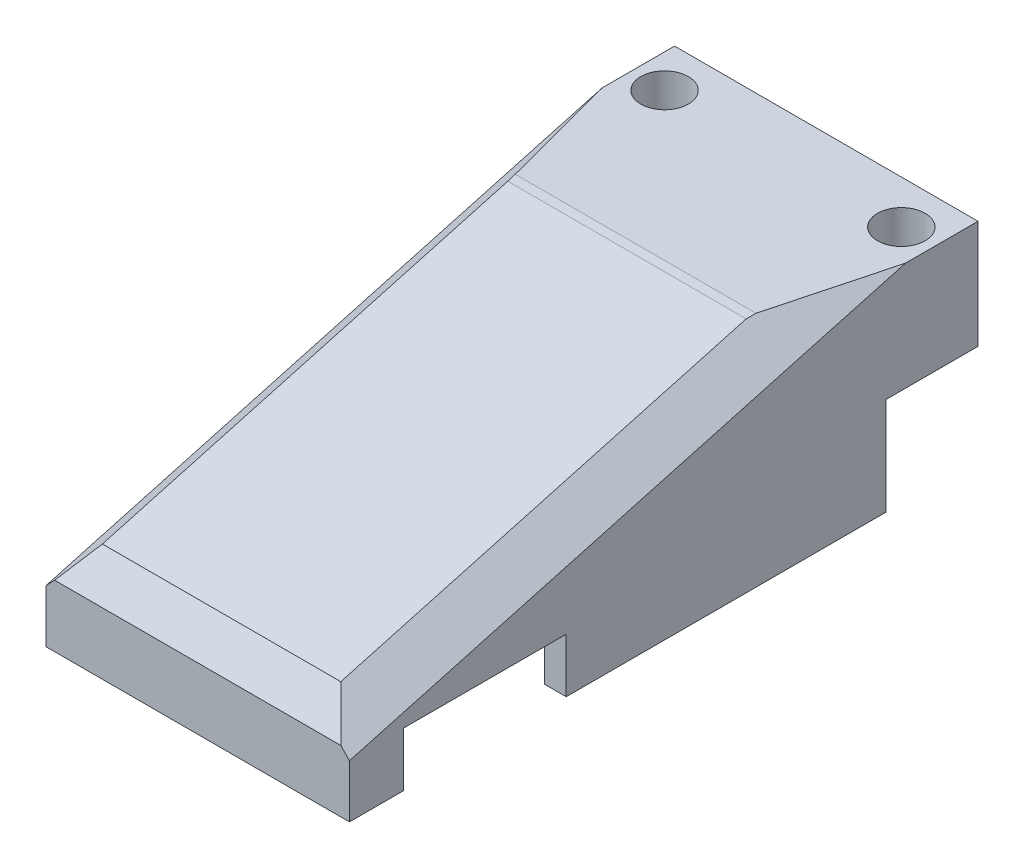
from build123d import *

# Parameters (mm, degrees)
BOSS_EXTRU_1_DEPTH                                = 4
ESQUISSE2_R                                       = 1.15
ENL_V_MAT_EXTRU_1_DEPTH                           = 18.663521733
CHAMBRAGE_POUR_VIS_SIX_PANS_CREUX_M21_D           = 2.2
CHAMBRAGE_POUR_VIS_SIX_PANS_CREUX_M21_CBORE_D     = 4.4
CHAMBRAGE_POUR_VIS_SIX_PANS_CREUX_M21_CBORE_DEPTH = 4
BOSS_EXTRU_2_DEPTH                                = 28
COQUE1_START                                      = -12
COQUE1_DEPTH                                      = 24
COQUE1_START_2                                    = -51.994775807
COQUE1_2_DEPTH                                    = 48.056615462
ENL_V_MAT_EXTRU_2_DEPTH                           = 11
ESQUISSE8_W                                       = 15
ESQUISSE8_H                                       = 5
ENL_V_MAT_EXTRU_3_DEPTH                           = 63


with BuildPart() as part:
    # Esquisse1 → Boss.-Extru.1 (new, symmetric)
    with BuildSketch(Plane.XY):
        Polygon((-14, 2), (-7.85, 2), (-7.85, 8.2), (4.95, 8.2), (7.85, 5.6), (7.85, 2), (14, 2), (14, 12), (-14, 12), align=None)
    extrude(amount=BOSS_EXTRU_1_DEPTH, both=True)

    # Esquisse2 → Enlèv. mat.-Extru.1 (cut, through all)
    with BuildSketch(Plane.XZ.offset(-2)):
        with Locations((10.925, 0)):
            Circle(ESQUISSE2_R)
        with Locations(Location((-10.925, 0, 0), (0, 0, 180))):
            Circle(ESQUISSE2_R)
    extrude(amount=-ENL_V_MAT_EXTRU_1_DEPTH, mode=Mode.SUBTRACT)

    # Chambrage pour vis à six pans creux M21 (through all)
    with Locations(Plane(origin=(0, 12, 0), x_dir=(1, 0, 0), z_dir=(0, 1, 0))):
        with Locations((-10.925, 0), (10.925, 0)):
            CounterBoreHole(CHAMBRAGE_POUR_VIS_SIX_PANS_CREUX_M21_D / 2, CHAMBRAGE_POUR_VIS_SIX_PANS_CREUX_M21_CBORE_D / 2, CHAMBRAGE_POUR_VIS_SIX_PANS_CREUX_M21_CBORE_DEPTH)

    # Esquisse6 → Boss.-Extru.2 (add)
    with BuildSketch(Plane.ZY.offset(14)):
        Polygon((4.5, 2), (4, 2), (4, 12), (14, 12), (54, 1), (54, -7), (4.5, -7), align=None)
    extrude(amount=-BOSS_EXTRU_2_DEPTH)

    # Chanfrein1
    # the kernel refuses this chamfer: 3 mm, written as the material it takes off along each edge
    with BuildSketch(Plane(origin=(-19.957306113, 1, 54), x_dir=(0, 0.2651564830210424, -0.9642053928037904), z_dir=(1, 0, 0))) as chanfrein1_piece_1:
        with BuildLine():
            Line((2.381812022, 0.07273839), (-0.701687646, -2.277268941))
            Line((-0.701687646, -2.277268941), (-0.75953997, -2.261359552))
            ThreePointArc((-0.75953997, -2.261359552), (-0.373628773, -1.132368609), (-0.057852324, 0.015909389))
            Line((-0.057852324, 0.015909389), (0, 0.06))
            ThreePointArc((0, 0.06), (1.190906011, 0.06), (2.381812022, 0.13273839))
            Line((2.381812022, 0.13273839), (2.381812022, 0.07273839))
        make_face()
    extrude(amount=39.914612227, mode=Mode.SUBTRACT)
    with BuildSketch(Plane(origin=(14, 15.477681924, 1.353883912), x_dir=(-1, 0, 0), z_dir=(0, -0.26515648302104217, 0.9642053928037905))) as chanfrein1_piece_2:
        with BuildLine():
            Line((3.084852814, -0.084852814), (-0.084852814, 3.084852814))
            Line((-0.084852814, 3.084852814), (-0.144852814, 3.084852814))
            ThreePointArc((-0.144852814, 3.084852814), (-0.06, 1.542426407), (-0.06, 0))
            Line((-0.06, 0), (0, -0.06))
            ThreePointArc((0, -0.06), (1.542426407, -0.06), (3.084852814, -0.144852814))
            Line((3.084852814, -0.144852814), (3.084852814, -0.084852814))
        make_face()
    extrude(amount=62.315569228, mode=Mode.SUBTRACT)
    with BuildSketch(Plane(origin=(-15.310375108, 12, 14), x_dir=(0, 0, -1), z_dir=(1, 0, 0))) as chanfrein1_piece_3:
        with BuildLine():
            Line((0.523904139, 0.016053697), (-0.509407938, -0.123437518))
            Line((-0.509407938, -0.123437518), (-0.525317327, -0.065585195))
            ThreePointArc((-0.525317327, -0.065585195), (-0.268484987, -0.011605966), (-0.015909389, 0.057852324))
            Line((-0.015909389, 0.057852324), (0, 0.06))
            ThreePointArc((0, 0.06), (0.261952069, 0.06), (0.523904139, 0.076053697))
            Line((0.523904139, 0.076053697), (0.523904139, 0.016053697))
        make_face()
    extrude(amount=30.620750216, mode=Mode.SUBTRACT)
    with BuildSketch(Plane(origin=(-14, 15.477681924, 1.353883912), x_dir=(1, 0, 0), z_dir=(0, -0.26515648302104217, 0.9642053928037905))) as chanfrein1_piece_4:
        with BuildLine():
            Line((3.084852814, 0.084852814), (-0.084852814, -3.084852814))
            Line((-0.084852814, -3.084852814), (-0.144852814, -3.084852814))
            ThreePointArc((-0.144852814, -3.084852814), (-0.06, -1.542426407), (-0.06, 0))
            Line((-0.06, 0), (0, 0.06))
            ThreePointArc((0, 0.06), (1.542426407, 0.06), (3.084852814, 0.144852814))
            Line((3.084852814, 0.144852814), (3.084852814, 0.084852814))
        make_face()
    extrude(amount=62.315569228, mode=Mode.SUBTRACT)

    # Coque1: read off the stored shape, not the designer's step
    # Coque1 outline → Coque1 (cut)
    with BuildSketch(Plane.YZ.offset(COQUE1_START)):
        Polygon((-7, 5.5), (10, 5.5), (10, 13.460632375), (9.928572392, 13.989748207), (-0.143118288, 50.614077951), (-1.961619074, 52), (-7, 52), align=None)
    extrude(amount=COQUE1_DEPTH, mode=Mode.SUBTRACT)

    # Coque1 2 outline → Coque1 2 (add)
    with BuildSketch(Plane(origin=(0, 0, 0), x_dir=(1, 0, 0), z_dir=(0, 0.26515648302104255, -0.9642053928037904)).offset(COQUE1_START_2)):
        Polygon((12, -11.454228351), (10.171572875, -13.282655476), (12, -13.282655476), align=None)
        Polygon((-10.171572875, -13.282655476), (-12, -11.454228351), (-12, -13.282655476), align=None)
    extrude(amount=COQUE1_2_DEPTH)

    # Esquisse7 → Enlèv. mat.-Extru.2 (cut)
    with BuildSketch(Plane(origin=(0, 0, -4), x_dir=(-1, 0, 0), z_dir=(0, 0, -1))):
        Polygon((-12, 2), (-12, -7), (12, -7), (12, 2), (7.85, 2), (-7.85, 2), align=None)
        Polygon((-7.85, 2), (7.85, 2), (7.85, 8.2), (-4.95, 8.2), (-7.85, 5.6), align=None)
    extrude(amount=-ENL_V_MAT_EXTRU_2_DEPTH, mode=Mode.SUBTRACT)

    # Esquisse8 → Enlèv. mat.-Extru.3 (cut, through all)
    with BuildSketch(Plane(origin=(14, 0, 0), x_dir=(0, 0, -1), z_dir=(1, 0, 0))):
        with Locations((-41.5, -4.5)):
            Rectangle(ESQUISSE8_W, ESQUISSE8_H)
    extrude(amount=-ENL_V_MAT_EXTRU_3_DEPTH, mode=Mode.SUBTRACT)


solid = part.part
